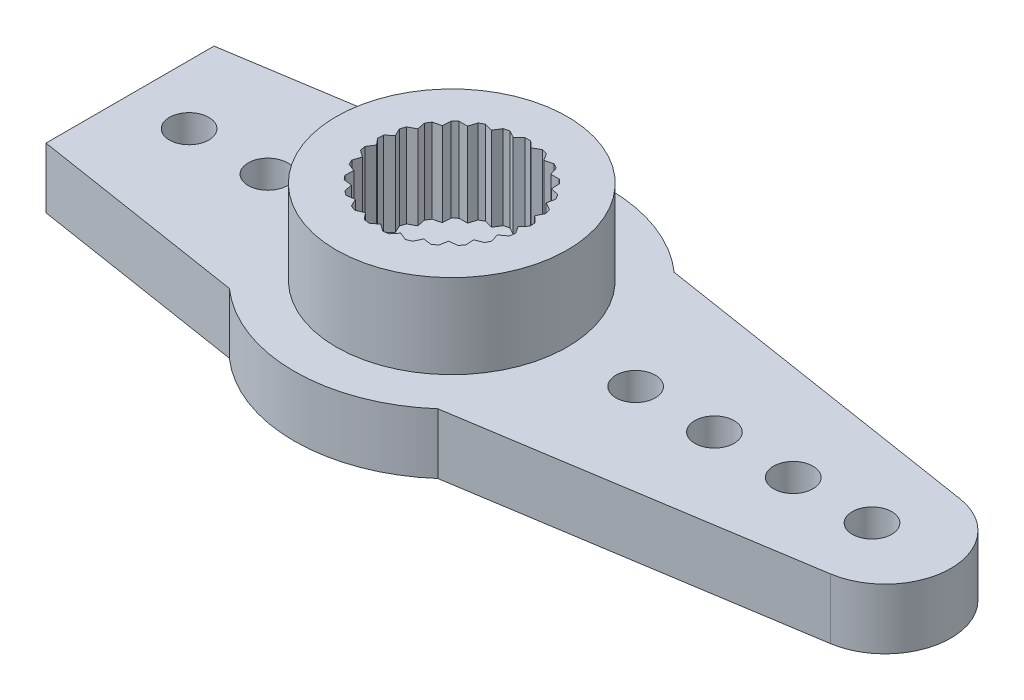
from build123d import *

# Parameters (mm, degrees)
SKETCH2_R           = 6
SKETCH2_R_2         = 1.5
BOSS_EXTRUDE1_DEPTH = 1.15
SKETCH3_R           = 4.4
BOSS_EXTRUDE2_DEPTH = 3.2
SKETCH4_R           = 0.75
BOSS_EXTRUDE3_DEPTH = 1.15
CIRPATTERN1_COUNT   = 2
CUT_EXTRUDE1_DEPTH  = 10


with BuildPart() as part:
    # Sketch2 → Boss-Extrude1 (new, symmetric)
    with BuildSketch(Plane(origin=(0, 0, 0), x_dir=(1, 0, 0), z_dir=(0, 1, 0))):
        Circle(SKETCH2_R)
        Circle(SKETCH2_R_2, mode=Mode.SUBTRACT)
    extrude(amount=BOSS_EXTRUDE1_DEPTH, both=True)

    # Sketch3 → Boss-Extrude2 (add)
    with BuildSketch(Plane(origin=(0, 1.15, 0), x_dir=(1, 0, 0), z_dir=(0, 1, 0))):
        Circle(SKETCH3_R)
        with BuildLine():
            Line((0.107421435, 2.898009771), (0.338399731, 2.678709694))
            Line((0.338399731, 2.678709694), (0.61665913, 2.83367809))
            ThreePointArc((0.61665913, 2.83367809), (0.721200673, 2.808891167), (0.824752316, 2.780248841))
            Line((0.824752316, 2.780248841), (0.993936292, 2.510396512))
            Line((0.993936292, 2.510396512), (1.301992734, 2.591295993))
            ThreePointArc((1.301992734, 2.591295993), (1.397085655, 2.541289372), (1.490260976, 2.48779465))
            Line((1.490260976, 2.48779465), (1.587020181, 2.184345885))
            Line((1.587020181, 2.184345885), (1.905517346, 2.186093238))
            ThreePointArc((1.905517346, 2.186093238), (1.985186607, 2.11400902), (2.062131058, 2.039023173))
            Line((2.062131058, 2.039023173), (2.080385755, 1.721044772))
            Line((2.080385755, 1.721044772), (2.389311295, 1.643530205))
            ThreePointArc((2.389311295, 1.643530205), (2.448550984, 1.553897705), (2.504429862, 1.46213237))
            Line((2.504429862, 1.46213237), (2.443033042, 1.149604087))
            Line((2.443033042, 1.149604087), (2.722976028, 0.997698125))
            ThreePointArc((2.722976028, 0.997698125), (2.758063897, 0.896149284), (2.789366126, 0.793370413))
            Line((2.789366126, 0.793370413), (2.652175577, 0.505929549))
            Line((2.652175577, 0.505929549), (2.885546163, 0.289177003))
            ThreePointArc((2.885546163, 0.289177003), (2.894277512, 0.182092507), (2.899036259, 0.074758075))
            Line((2.899036259, 0.074758075), (2.694672167, -0.169534403))
            Line((2.694672167, -0.169534403), (2.866806821, -0.437514174))
            ThreePointArc((2.866806821, -0.437514174), (2.848633027, -0.543405812), (2.826549281, -0.648551587))
            Line((2.826549281, -0.648551587), (2.567852594, -0.834345885))
            Line((2.567852594, -0.834345885), (2.667935462, -1.136714727))
            ThreePointArc((2.667935462, -1.136714727), (2.623998452, -1.234759946), (2.576459817, -1.331110368))
            Line((2.576459817, -1.331110368), (2.279685399, -1.446732346))
            Line((2.279685399, -1.446732346), (2.301427906, -1.764491312))
            ThreePointArc((2.301427906, -1.764491312), (2.234488404, -1.84852957), (2.164481907, -1.930030589))
            Line((2.164481907, -1.930030589), (1.848277186, -1.968215294))
            Line((1.848277186, -1.968215294), (1.790313171, -2.281398419))
            ThreePointArc((1.790313171, -2.281398419), (1.704577232, -2.346149284), (1.616501638, -2.40767989))
            Line((1.616501638, -2.40767989), (1.30073492, -2.366028036))
            Line((1.30073492, -2.366028036), (1.166706475, -2.654956874))
            ThreePointArc((1.166706475, -2.654956874), (1.067561203, -2.696351809), (0.966950626, -2.734045809))
            Line((0.966950626, -2.734045809), (0.671462695, -2.615174535))
            Line((0.671462695, -2.615174535), (0.469791321, -2.861694623))
            ThreePointArc((0.469791321, -2.861694623), (0.363466377, -2.877132634), (0.25664255, -2.888621575))
            Line((0.25664255, -2.888621575), (0, -2.7))
            Line((0, -2.7), (-0.25664255, -2.888621575))
            ThreePointArc((-0.25664255, -2.888621575), (-0.363466377, -2.877132634), (-0.469791321, -2.861694623))
            Line((-0.469791321, -2.861694623), (-0.671462695, -2.615174535))
            Line((-0.671462695, -2.615174535), (-0.966950626, -2.734045809))
            ThreePointArc((-0.966950626, -2.734045809), (-1.067561203, -2.696351809), (-1.166706475, -2.654956874))
            Line((-1.166706475, -2.654956874), (-1.30073492, -2.366028036))
            Line((-1.30073492, -2.366028036), (-1.616501638, -2.40767989))
            ThreePointArc((-1.616501638, -2.40767989), (-1.704577232, -2.346149284), (-1.790313171, -2.281398419))
            Line((-1.790313171, -2.281398419), (-1.848277186, -1.968215294))
            Line((-1.848277186, -1.968215294), (-2.164481907, -1.930030589))
            ThreePointArc((-2.164481907, -1.930030589), (-2.234488404, -1.84852957), (-2.301427906, -1.764491312))
            Line((-2.301427906, -1.764491312), (-2.279685399, -1.446732346))
            Line((-2.279685399, -1.446732346), (-2.576459817, -1.331110368))
            ThreePointArc((-2.576459817, -1.331110368), (-2.623998452, -1.234759946), (-2.667935462, -1.136714727))
            Line((-2.667935462, -1.136714727), (-2.567852594, -0.834345885))
            Line((-2.567852594, -0.834345885), (-2.826549281, -0.648551587))
            ThreePointArc((-2.826549281, -0.648551587), (-2.848633027, -0.543405812), (-2.866806821, -0.437514174))
            Line((-2.866806821, -0.437514174), (-2.694672167, -0.169534403))
            Line((-2.694672167, -0.169534403), (-2.899036259, 0.074758075))
            ThreePointArc((-2.899036259, 0.074758075), (-2.894277512, 0.182092507), (-2.885546163, 0.289177003))
            Line((-2.885546163, 0.289177003), (-2.652175577, 0.505929549))
            Line((-2.652175577, 0.505929549), (-2.789366126, 0.793370413))
            ThreePointArc((-2.789366126, 0.793370413), (-2.758063897, 0.896149284), (-2.722976028, 0.997698125))
            Line((-2.722976028, 0.997698125), (-2.443033042, 1.149604087))
            Line((-2.443033042, 1.149604087), (-2.504429862, 1.46213237))
            ThreePointArc((-2.504429862, 1.46213237), (-2.448550984, 1.553897705), (-2.389311295, 1.643530205))
            Line((-2.389311295, 1.643530205), (-2.080385755, 1.721044772))
            Line((-2.080385755, 1.721044772), (-2.062131058, 2.039023173))
            ThreePointArc((-2.062131058, 2.039023173), (-1.985186607, 2.11400902), (-1.905517346, 2.186093238))
            Line((-1.905517346, 2.186093238), (-1.587020181, 2.184345885))
            Line((-1.587020181, 2.184345885), (-1.490260976, 2.48779465))
            ThreePointArc((-1.490260976, 2.48779465), (-1.397085655, 2.541289372), (-1.301992734, 2.591295993))
            Line((-1.301992734, 2.591295993), (-0.993936292, 2.510396512))
            Line((-0.993936292, 2.510396512), (-0.824752316, 2.780248841))
            ThreePointArc((-0.824752316, 2.780248841), (-0.721200673, 2.808891167), (-0.61665913, 2.83367809))
            Line((-0.61665913, 2.83367809), (-0.338399731, 2.678709694))
            Line((-0.338399731, 2.678709694), (-0.107421435, 2.898009771))
            ThreePointArc((-0.107421435, 2.898009771), (0, 2.9), (0.107421435, 2.898009771))
        make_face(mode=Mode.SUBTRACT)
    extrude(amount=BOSS_EXTRUDE2_DEPTH)

    # Sketch4 → Boss-Extrude3 (add, symmetric)
    with BuildSketch(Plane(origin=(0, 0, 0), x_dir=(1, 0, 0), z_dir=(0, 1, 0))):
        with BuildLine():
            Line((3.968626967, 4.5), (16.888114198, 2.469689731))
            ThreePointArc((16.888114198, 2.469689731), (19, 0), (16.888114198, -2.469689731))
            Line((16.888114198, -2.469689731), (3.968626967, -4.5))
            ThreePointArc((3.968626967, -4.5), (6, 0), (3.968626967, 4.5))
        make_face()
        with Locations((16, 0)):
            Circle(SKETCH4_R, mode=Mode.SUBTRACT)
        with Locations((13, 0)):
            Circle(SKETCH4_R, mode=Mode.SUBTRACT)
        with Locations((10, 0)):
            Circle(SKETCH4_R, mode=Mode.SUBTRACT)
        with Locations((7, 0)):
            Circle(SKETCH4_R, mode=Mode.SUBTRACT)
    boss_extrude3 = extrude(amount=BOSS_EXTRUDE3_DEPTH, both=True)

    # CirPattern1: Boss-Extrude3 ×2 about axis
    cirpattern1_axis = Axis((0, 4.35, 0), (0, 1, 0))
    for i in range(1, CIRPATTERN1_COUNT):
        add(boss_extrude3.rotate(cirpattern1_axis, i * 360 / CIRPATTERN1_COUNT))

    # Sketch6 → Cut-Extrude1 (cut)
    with BuildSketch(Plane.XZ.offset(1.15)):
        Polygon((-12.25, 0), (-12.25, 5.932687926), (-21.293207436, 5.932687926), (-21.293207436, 0), (-21.293207436, -7.371619722), (-12.25, -7.371619722), align=None)
    extrude(amount=-CUT_EXTRUDE1_DEPTH, mode=Mode.SUBTRACT)


solid = part.part
